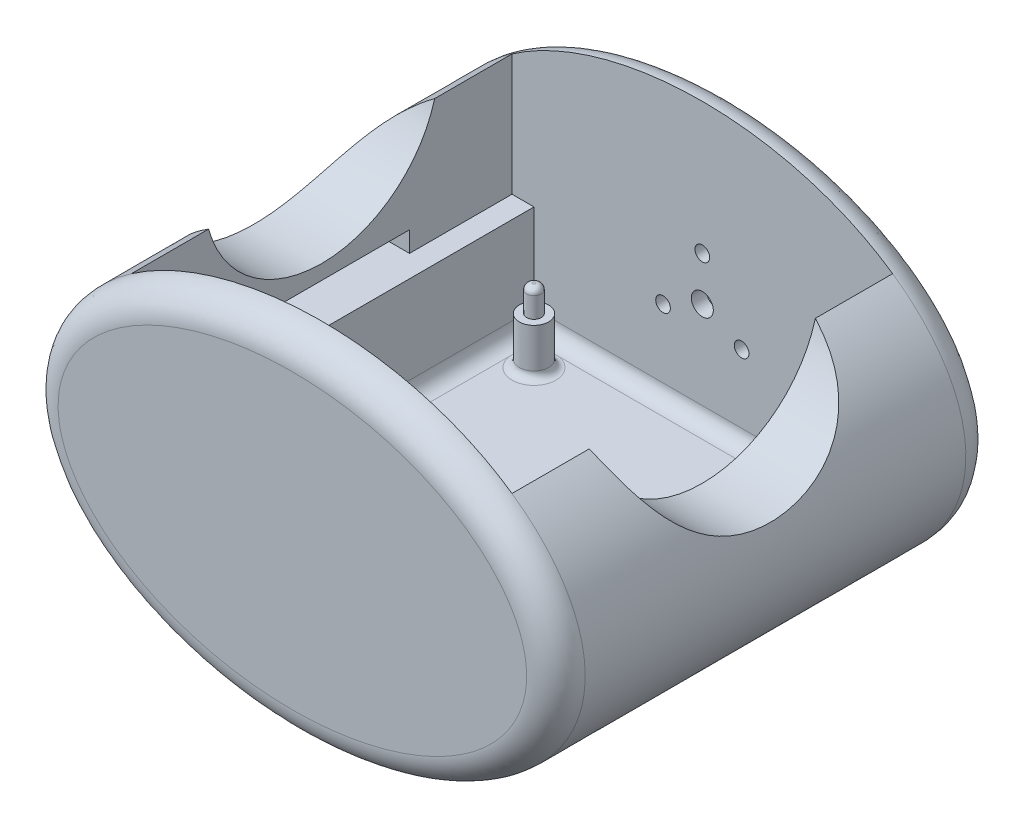
from build123d import *

# Parameters (mm, degrees)
SKETCH1_RX               = 22.86
SKETCH1_RY               = 15.24
BOSS_EXTRUDE4_DEPTH      = 45.72
CUT_EXTRUDE2_START       = -10.16
SKETCH4_W                = 29.21
SKETCH4_H                = 17.78
CUT_EXTRUDE2_DEPTH       = 33.02
CUT_EXTRUDE4_DEPTH       = 33.02
CUT_EXTRUDE4_DEPTH_BACK  = 33.02
SKETCH7_W                = 14.643913221
SKETCH7_H                = 35.56
SKETCH8_R                = 0.9525
SKETCH8_R_2              = 0.635
CUT_EXTRUDE5_DEPTH       = 2.54
FILLET1_R                = 2.54
FILLET2_R                = 2.54
FILLET3_R                = 1.27
CUT_EXTRUDE13_START      = -2.54
SKETCH13_R               = 3.175
CUT_EXTRUDE13_DEPTH      = 49.021314431
CUT_EXTRUDE14_DEPTH      = 52.821602807
CUT_EXTRUDE14_DEPTH_BACK = 52.821602807
SKETCH14_R               = 0.5
CUT_EXTRUDE16_START      = -2.54
SKETCH12_W               = 33.02
SKETCH12_H               = 19.05
CUT_EXTRUDE16_DEPTH      = 33.02
SKETCH17_W               = 15.24
SKETCH17_H               = 1.778
CUT_EXTRUDE17_DEPTH      = 1.778
SKETCH18_W               = 15.24
SKETCH18_H               = 1.778
CUT_EXTRUDE18_DEPTH      = 1.778
CUT_EXTRUDE19_DEPTH      = 47.972834865
CUT_EXTRUDE19_DEPTH_BACK = 47.972834865
SKETCH19_R               = 10.16
SKETCH20_R               = 1.27
SKETCH20_R_2             = 0.635
BOSS_EXTRUDE5_DEPTH      = 4.064
SKETCH22_R               = 0.635
BOSS_EXTRUDE6_DEPTH      = 6.35
FILLET4_R                = 0.635
FILLET5_R                = 0.508
SKETCH23_R               = 2
CUT_EXTRUDE20_DEPTH      = 1.27


with BuildPart() as part:
    # Sketch1 → Boss-Extrude4 (new body)
    with BuildSketch(Plane.XY):
        with Locations(Location((0, 0), (0, 0, 180))):
            Ellipse(SKETCH1_RX, SKETCH1_RY)
    extrude(amount=BOSS_EXTRUDE4_DEPTH)

    # Sketch4 → Cut-Extrude2 (cut)
    with BuildSketch(Plane.XY.offset(45.72).offset(CUT_EXTRUDE2_START)):
        Rectangle(SKETCH4_W, SKETCH4_H)
    extrude(amount=-CUT_EXTRUDE2_DEPTH, mode=Mode.SUBTRACT)

    # Sketch7 → Cut-Extrude4 (cut, two sides: drawn at the far end of the back side and taken through both)
    with BuildSketch(Plane(origin=(0, 0, 0), x_dir=(0, 0, -1), z_dir=(1, 0, 0)).offset(-CUT_EXTRUDE4_DEPTH_BACK)):
        with Locations((-45.421956611, -1.677648267)):
            Rectangle(SKETCH7_W, SKETCH7_H)
    extrude(amount=CUT_EXTRUDE4_DEPTH + CUT_EXTRUDE4_DEPTH_BACK, mode=Mode.SUBTRACT)

    # Sketch8 → Cut-Extrude5 (cut)
    with BuildSketch(Plane.XY):
        Circle(SKETCH8_R)
        with Locations((3.407767598, -1.703883799)):
            Circle(SKETCH8_R_2)
        with Locations((-3.407767598, -1.703883799)):
            Circle(SKETCH8_R_2)
        with Locations((0, 3.81)):
            Circle(SKETCH8_R_2)
    extrude(amount=CUT_EXTRUDE5_DEPTH, mode=Mode.SUBTRACT)

    # Fillet1
    fillet1_edges = [part.edges().sort_by_distance(p)[0] for p in [
        (22.859987041, 0.016227247, 0),
    ]]
    fillet(fillet1_edges, radius=FILLET1_R)

    # Fillet2
    fillet2_edges = [part.edges().sort_by_distance(p)[0] for p in [
        (22.860000074, -1.7e-08, 38.1),
    ]]
    fillet(fillet2_edges, radius=FILLET2_R)

    # Fillet3
    fillet3_edges = [part.edges().sort_by_distance(p)[0] for p in [
        (14.605, -8.89, 19.05),
        (0, -8.89, 35.56),
        (-14.605, -8.89, 19.05),
        (0, -8.89, 2.54),
    ]]
    fillet(fillet3_edges, radius=FILLET3_R)

    # Sketch13 → Cut-Extrude13 (cut, through all)
    with BuildSketch(Plane(origin=(0, -8.89, 0), x_dir=(1, 0, 0), z_dir=(0, 1, 0)).offset(CUT_EXTRUDE13_START)):
        with Locations(Location((0, -19.05, 0), (0, 0, 180))):
            Circle(SKETCH13_R)
    extrude(amount=-CUT_EXTRUDE13_DEPTH, mode=Mode.SUBTRACT)

    # Sketch14 → Cut-Extrude14 (cut, two sides: drawn at the far end of the back side and taken through both)
    with BuildSketch(Plane.XZ.offset(11.43).offset(-CUT_EXTRUDE14_DEPTH_BACK)):
        with Locations(Location((0, 20.955, 0), (0, 0, 180))):
            Circle(SKETCH14_R)
        with Locations(Location((0, 17.145, 0), (0, 0, 180))):
            Circle(SKETCH14_R)
    extrude(amount=CUT_EXTRUDE14_DEPTH + CUT_EXTRUDE14_DEPTH_BACK, mode=Mode.SUBTRACT)

    # Sketch12 → Cut-Extrude16 (cut)
    with BuildSketch(Plane(origin=(0, 0, 0), x_dir=(-1, 0, 0), z_dir=(0, 0, -1)).offset(CUT_EXTRUDE16_START)):
        with Locations((0, 9.525)):
            Rectangle(SKETCH12_W, SKETCH12_H)
    extrude(amount=-CUT_EXTRUDE16_DEPTH, mode=Mode.SUBTRACT)

    # Sketch17 → Cut-Extrude17 (cut)
    with BuildSketch(Plane.ZY.offset(-16.51)):
        with Locations((19.05, 0.889)):
            Rectangle(SKETCH17_W, SKETCH17_H)
    extrude(amount=-CUT_EXTRUDE17_DEPTH, mode=Mode.SUBTRACT)

    # Sketch18 → Cut-Extrude18 (cut)
    with BuildSketch(Plane(origin=(-16.51, 0, 0), x_dir=(0, 0, -1), z_dir=(1, 0, 0))):
        with Locations((-19.05, 0.889)):
            Rectangle(SKETCH18_W, SKETCH18_H)
    extrude(amount=-CUT_EXTRUDE18_DEPTH, mode=Mode.SUBTRACT)

    # Sketch19 → Cut-Extrude19 (cut, two sides: drawn at the far end of the back side and taken through both)
    with BuildSketch(Plane(origin=(0, 0, 0), x_dir=(0, 0, -1), z_dir=(1, 0, 0)).offset(-CUT_EXTRUDE19_DEPTH_BACK)):
        with Locations((-19.05, 13.208)):
            Circle(SKETCH19_R)
    extrude(amount=CUT_EXTRUDE19_DEPTH + CUT_EXTRUDE19_DEPTH_BACK, mode=Mode.SUBTRACT)

    # Sketch20 → Boss-Extrude5 (add)
    # profile 1 of 4: a face of its own
    with BuildSketch(Plane(origin=(0, -8.89, 0), x_dir=(1, 0, 0), z_dir=(0, 1, 0))):
        with Locations((-11.43, -32.385)):
            Circle(SKETCH20_R)
        with Locations(Location((-11.43, -32.385, 0), (0, 0, 180))):
            Circle(SKETCH20_R_2, mode=Mode.SUBTRACT)
    # profile 2 of 4: a face of its own
    with BuildSketch(Plane(origin=(0, -8.89, 0), x_dir=(1, 0, 0), z_dir=(0, 1, 0))):
        with Locations((-11.43, -5.715)):
            Circle(SKETCH20_R)
        with Locations(Location((-11.43, -5.715, 0), (0, 0, 180))):
            Circle(SKETCH20_R_2, mode=Mode.SUBTRACT)
    # profile 3 of 4: a face of its own
    with BuildSketch(Plane(origin=(0, -8.89, 0), x_dir=(1, 0, 0), z_dir=(0, 1, 0))):
        with Locations((11.43, -32.385)):
            Circle(SKETCH20_R)
        with Locations(Location((11.43, -32.385, 0), (0, 0, 180))):
            Circle(SKETCH20_R_2, mode=Mode.SUBTRACT)
    # profile 4 of 4: a face of its own
    with BuildSketch(Plane(origin=(0, -8.89, 0), x_dir=(1, 0, 0), z_dir=(0, 1, 0))):
        with Locations((11.43, -5.715)):
            Circle(SKETCH20_R)
        with Locations(Location((11.43, -5.715, 0), (0, 0, 180))):
            Circle(SKETCH20_R_2, mode=Mode.SUBTRACT)
    extrude(amount=BOSS_EXTRUDE5_DEPTH)

    # Sketch22 → Boss-Extrude6 (add)
    with BuildSketch(Plane(origin=(0, -8.89, 0), x_dir=(1, 0, 0), z_dir=(0, 1, 0))):
        with Locations(Location((-11.43, -32.385, 0), (0, 0, 180))):
            Circle(SKETCH22_R)
        with Locations(Location((-11.43, -5.715, 0), (0, 0, 180))):
            Circle(SKETCH22_R)
        with Locations(Location((11.43, -5.715, 0), (0, 0, 180))):
            Circle(SKETCH22_R)
        with Locations(Location((11.43, -32.385, 0), (0, 0, 180))):
            Circle(SKETCH22_R)
    extrude(amount=BOSS_EXTRUDE6_DEPTH)

    # Fillet4
    fillet4_edges = [part.edges().sort_by_distance(p)[0] for p in [
        (-12.7, -8.89, 32.385),
        (-12.7, -8.89, 5.715),
        (10.16, -8.89, 32.385),
        (10.16, -8.89, 5.715),
    ]]
    fillet(fillet4_edges, radius=FILLET4_R - 0.0001)  # a hair under: the kernel refuses the full size

    # Fillet5
    fillet5_edges = [part.edges().sort_by_distance(p)[0] for p in [
        (-10.795, -2.54, 32.385),
        (-10.795, -2.54, 5.715),
        (12.065, -2.54, 5.715),
        (12.065, -2.54, 32.385),
    ]]
    fillet(fillet5_edges, radius=FILLET5_R)

    # Sketch23 → Cut-Extrude20 (cut)
    with BuildSketch(Plane(origin=(0, 0, 0), x_dir=(-1, 0, 0), z_dir=(0, 0, -1))):
        with Locations((0, 2.5)):
            Circle(SKETCH23_R)
        with Locations((2.165063509, -1.25)):
            Circle(SKETCH23_R)
        with Locations((-2.165063509, -1.25)):
            Circle(SKETCH23_R)
    extrude(amount=-CUT_EXTRUDE20_DEPTH, mode=Mode.SUBTRACT)


solid = part.part
